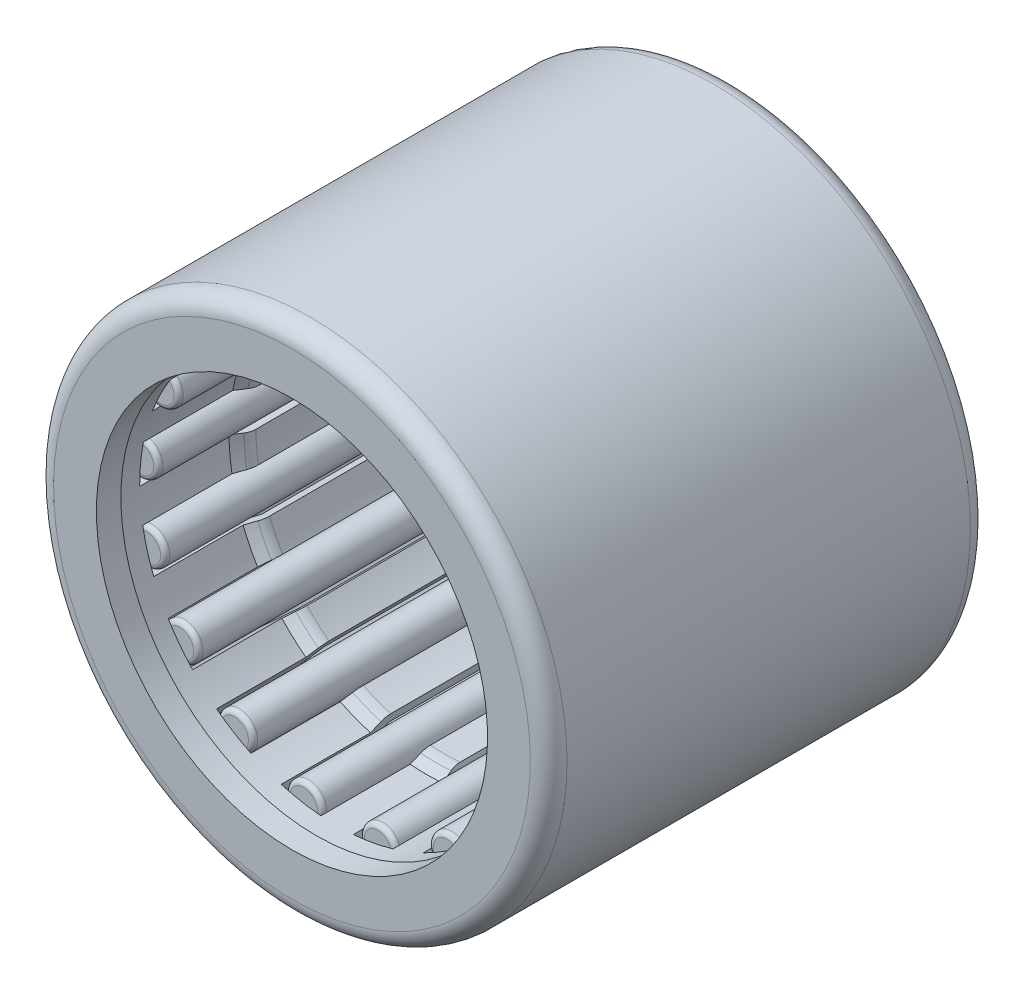
from build123d import *

# Parameters (mm, degrees)
FILLET1_R          = 0.5
SKETCH4_W          = 9.333333334
SKETCH4_H          = 0.5
FILLET2_R          = 0.127
CIRPATTERN2_COUNT  = 17
FILLET3_R          = 0.508
SKETCH6_W          = 1.1016
SKETCH6_H          = 1.1016
CUT_EXTRUDE1_DEPTH = 4.768267
CIRPATTERN8_COUNT  = 17


with BuildPart() as part:
    # Sketch2 → Revolve1 (revolve)
    with BuildSketch(Plane(origin=(0, 0, 0), x_dir=(0, 0, -1), z_dir=(1, 0, 0)), mode=Mode.PRIVATE) as revolve1_sk:
        Polygon((5.333333333, 6.333333333), (5.333333333, 5.333333333), (6, 5.333333333), (6, 7), (-6, 7), (-6, 5.333333333), (-5.333333333, 5.333333333), (-5.333333333, 6.333333333), align=None)
    revolve(revolve1_sk.sketch.rotate(Axis((0, 0, 6), (0, 0, -1)), 180), axis=Axis((0, 0, 6), (0, 0, -1)))

    # Fillet1
    fillet1_edges = [part.edges().sort_by_distance(p)[0] for p in [
        (0, 7, -6),
        (0, 7, 6),
    ]]
    fillet(fillet1_edges, radius=FILLET1_R)


with BuildPart() as body_2:
    # Sketch4 → Revolve2 (revolve)
    with BuildSketch(Plane(origin=(0, 0, 0), x_dir=(0, 0, -1), z_dir=(1, 0, 0)), mode=Mode.PRIVATE) as revolve2_sk:
        with Locations((0, 5.25)):
            Rectangle(SKETCH4_W, SKETCH4_H)
    revolve(revolve2_sk.sketch.rotate(Axis((0, 5.5, 4.666666667), (0, 0, -1)), 270), axis=Axis((0, 5.5, 4.666666667), (0, 0, -1)))

    # Fillet2
    fillet2_edges = [body_2.edges().sort_by_distance(p)[0] for p in [
        (-0.5, 5.5, 4.666666667),
        (-0.5, 5.5, -4.666666667),
    ]]
    fillet(fillet2_edges, radius=FILLET2_R)


with BuildPart() as cirpattern2_1:
    # CirPattern2: pattern copy
    add(body_2.part.rotate(Axis((0, 0, 0), (0, 0, 1)), 1 * 360 / CIRPATTERN2_COUNT))


with BuildPart() as cirpattern2_2:
    # CirPattern2: pattern copy
    add(body_2.part.rotate(Axis((0, 0, 0), (0, 0, 1)), 2 * 360 / CIRPATTERN2_COUNT))


with BuildPart() as cirpattern2_3:
    # CirPattern2: pattern copy
    add(body_2.part.rotate(Axis((0, 0, 0), (0, 0, 1)), 3 * 360 / CIRPATTERN2_COUNT))


with BuildPart() as cirpattern2_4:
    # CirPattern2: pattern copy
    add(body_2.part.rotate(Axis((0, 0, 0), (0, 0, 1)), 4 * 360 / CIRPATTERN2_COUNT))


with BuildPart() as cirpattern2_5:
    # CirPattern2: pattern copy
    add(body_2.part.rotate(Axis((0, 0, 0), (0, 0, 1)), 5 * 360 / CIRPATTERN2_COUNT))


with BuildPart() as cirpattern2_6:
    # CirPattern2: pattern copy
    add(body_2.part.rotate(Axis((0, 0, 0), (0, 0, 1)), 6 * 360 / CIRPATTERN2_COUNT))


with BuildPart() as cirpattern2_7:
    # CirPattern2: pattern copy
    add(body_2.part.rotate(Axis((0, 0, 0), (0, 0, 1)), 7 * 360 / CIRPATTERN2_COUNT))


with BuildPart() as cirpattern2_8:
    # CirPattern2: pattern copy
    add(body_2.part.rotate(Axis((0, 0, 0), (0, 0, 1)), 8 * 360 / CIRPATTERN2_COUNT))


with BuildPart() as cirpattern2_9:
    # CirPattern2: pattern copy
    add(body_2.part.rotate(Axis((0, 0, 0), (0, 0, 1)), 9 * 360 / CIRPATTERN2_COUNT))


with BuildPart() as cirpattern2_10:
    # CirPattern2: pattern copy
    add(body_2.part.rotate(Axis((0, 0, 0), (0, 0, 1)), 10 * 360 / CIRPATTERN2_COUNT))


with BuildPart() as cirpattern2_11:
    # CirPattern2: pattern copy
    add(body_2.part.rotate(Axis((0, 0, 0), (0, 0, 1)), 11 * 360 / CIRPATTERN2_COUNT))


with BuildPart() as cirpattern2_12:
    # CirPattern2: pattern copy
    add(body_2.part.rotate(Axis((0, 0, 0), (0, 0, 1)), 12 * 360 / CIRPATTERN2_COUNT))


with BuildPart() as cirpattern2_13:
    # CirPattern2: pattern copy
    add(body_2.part.rotate(Axis((0, 0, 0), (0, 0, 1)), 13 * 360 / CIRPATTERN2_COUNT))


with BuildPart() as cirpattern2_14:
    # CirPattern2: pattern copy
    add(body_2.part.rotate(Axis((0, 0, 0), (0, 0, 1)), 14 * 360 / CIRPATTERN2_COUNT))


with BuildPart() as cirpattern2_15:
    # CirPattern2: pattern copy
    add(body_2.part.rotate(Axis((0, 0, 0), (0, 0, 1)), 15 * 360 / CIRPATTERN2_COUNT))


with BuildPart() as cirpattern2_16:
    # CirPattern2: pattern copy
    add(body_2.part.rotate(Axis((0, 0, 0), (0, 0, 1)), 16 * 360 / CIRPATTERN2_COUNT))


with BuildPart() as body_19:
    # Sketch5 → Revolve3 (revolve)
    with BuildSketch(Plane(origin=(0, 0, 0), x_dir=(0, 0, -1), z_dir=(1, 0, 0)), mode=Mode.PRIVATE) as revolve3_sk:
        Polygon((-5.333333333, 5.384133333), (-5.333333333, 5.833333333), (-2.609152802, 5.833333333), (-1.831115579, 5.384133333), (1.831115579, 5.384133333), (2.609152802, 5.833333333), (5.333333333, 5.833333333), (5.333333333, 5.384133333), (2.333333333, 5.384133333), (1.956670018, 5.166666667), (-1.956670018, 5.166666667), (-2.333333333, 5.384133333), align=None)
    revolve(revolve3_sk.sketch.rotate(Axis((0, 0, 6), (0, 0, -1)), 180), axis=Axis((0, 0, 6), (0, 0, -1)))

    # Fillet3
    fillet3_edges = [body_19.edges().sort_by_distance(p)[0] for p in [
        (0, 5.166666667, -1.956670018),
        (0, 5.166666667, 1.956670018),
    ]]
    fillet(fillet3_edges, radius=FILLET3_R)

    # Sketch6 → Cut-Extrude1 (cut, symmetric)
    with BuildSketch(Plane.XY):
        with Locations((0, 5.5)):
            Rectangle(SKETCH6_W, SKETCH6_H)
    cut_extrude1 = extrude(amount=CUT_EXTRUDE1_DEPTH, both=True, mode=Mode.SUBTRACT)

    # CirPattern8: Cut-Extrude1 ×17 about axis
    cirpattern8_axis = Axis((0, 0, 0), (0, 0, 1))
    for i in range(1, CIRPATTERN8_COUNT):
        add(cut_extrude1.rotate(cirpattern8_axis, i * 360 / CIRPATTERN8_COUNT), mode=Mode.SUBTRACT)


solid = Compound([part.part, body_2.part, cirpattern2_1.part, cirpattern2_2.part, cirpattern2_3.part, cirpattern2_4.part, cirpattern2_5.part, cirpattern2_6.part, cirpattern2_7.part, cirpattern2_8.part, cirpattern2_9.part, cirpattern2_10.part, cirpattern2_11.part, cirpattern2_12.part, cirpattern2_13.part, cirpattern2_14.part, cirpattern2_15.part, cirpattern2_16.part, body_19.part])
